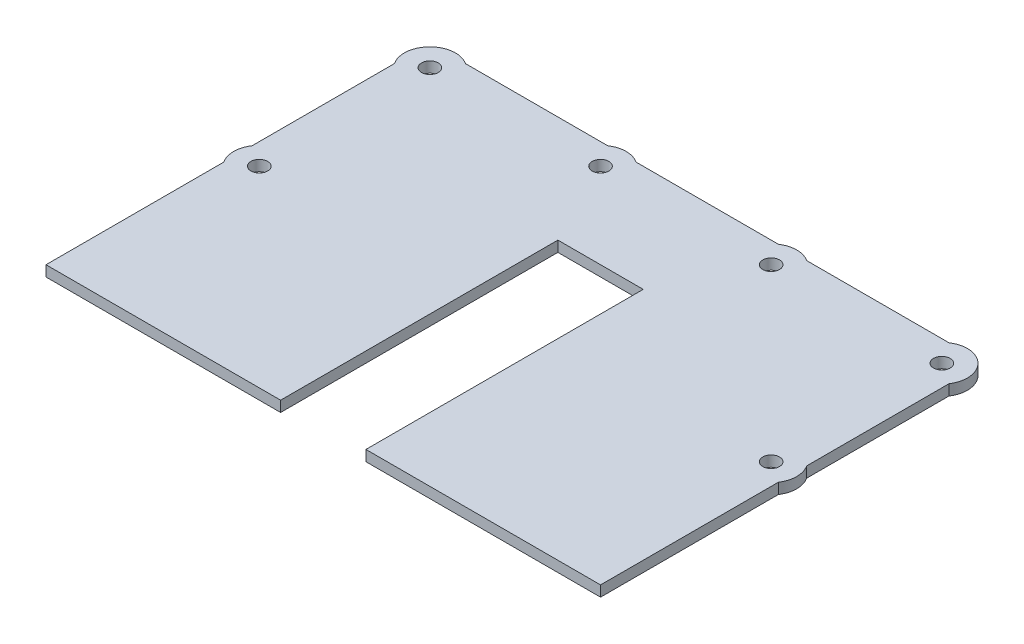
from build123d import *

# Parameters (mm, degrees)
SKETCH1_R           = 2.4892
BOSS_EXTRUDE1_DEPTH = 3.175
SKETCH7_W           = 69.85
SKETCH7_H           = 3.802256124
BOSS_EXTRUDE2_DEPTH = 3.175
SKETCH8_W           = 69.85
SKETCH8_H           = 3.802256124
BOSS_EXTRUDE4_DEPTH = 3.175
CUT_EXTRUDE1_DEPTH  = 203.596847026
SKETCH10_W          = 3.824961128
SKETCH10_H          = 3.22787153
CUT_EXTRUDE2_DEPTH  = 203.596847026


with BuildPart() as part:
    # Sketch1 → Boss-Extrude1 (new body)
    with BuildSketch(Plane(origin=(0, 0, 0), x_dir=(1, 0, 0), z_dir=(0, 1, 0))):
        with BuildLine():
            Line((-61.362113484, 114.3), (-103.737886516, 114.3))
            ThreePointArc((-103.737886516, 114.3), (-107.95, 115.57), (-112.162113484, 114.3))
            Line((-112.162113484, 114.3), (-154.537886516, 114.3))
            ThreePointArc((-154.537886516, 114.3), (-164.138153673, 113.338153673), (-165.1, 103.737886516))
            Line((-165.1, 103.737886516), (-165.1, 61.362113484))
            ThreePointArc((-165.1, 61.362113484), (-166.37, 57.15), (-165.1, 52.937886516))
            Line((-165.1, 52.937886516), (-165.1, 0))
            Line((-165.1, 0), (-95.25, 0))
            Line((-95.25, 0), (-95.25, 82.55))
            Line((-95.25, 82.55), (-69.85, 82.55))
            Line((-69.85, 82.55), (-69.85, 0))
            Line((-69.85, 0), (0, 0))
            Line((0, 0), (0, 52.937886516))
            ThreePointArc((0, 52.937886516), (1.27, 57.15), (0, 61.362113484))
            Line((0, 61.362113484), (0, 103.737886516))
            ThreePointArc((0, 103.737886516), (-0.961846327, 113.338153673), (-10.562113484, 114.3))
            Line((-10.562113484, 114.3), (-52.937886516, 114.3))
            ThreePointArc((-52.937886516, 114.3), (-57.15, 115.57), (-61.362113484, 114.3))
        make_face()
        with Locations((-158.75, 57.15)):
            Circle(SKETCH1_R, mode=Mode.SUBTRACT)
        with Locations((-6.35, 57.15)):
            Circle(SKETCH1_R, mode=Mode.SUBTRACT)
        with Locations((-158.75, 107.95)):
            Circle(SKETCH1_R, mode=Mode.SUBTRACT)
        with Locations((-107.95, 107.95)):
            Circle(SKETCH1_R, mode=Mode.SUBTRACT)
        with Locations((-57.15, 107.95)):
            Circle(SKETCH1_R, mode=Mode.SUBTRACT)
        with Locations((-6.35, 107.95)):
            Circle(SKETCH1_R, mode=Mode.SUBTRACT)
    extrude(amount=BOSS_EXTRUDE1_DEPTH)

    # Sketch7 → Boss-Extrude2 (add)
    with BuildSketch(Plane(origin=(0, 3.175, 0), x_dir=(1, 0, 0), z_dir=(0, 1, 0))):
        with Locations((-34.925, -1.901128062)):
            Rectangle(SKETCH7_W, SKETCH7_H)
    extrude(amount=-BOSS_EXTRUDE2_DEPTH)

    # Sketch8 → Boss-Extrude4 (add)
    with BuildSketch(Plane.XZ):
        with Locations((-130.175, 1.901128062)):
            Rectangle(SKETCH8_W, SKETCH8_H)
    extrude(amount=-BOSS_EXTRUDE4_DEPTH)

    # Sketch9 → Cut-Extrude1 (cut, through all)
    with BuildSketch(Plane.ZY.offset(165.1)):
        Polygon((0, 3.175), (3.802256124, 0), (3.802256124, 3.175), align=None)
    extrude(amount=-CUT_EXTRUDE1_DEPTH, mode=Mode.SUBTRACT)

    # Sketch10 → Cut-Extrude2 (cut, through all)
    with BuildSketch(Plane.ZY.offset(165.1)):
        with Locations((1.912480564, 1.613935765)):
            Rectangle(SKETCH10_W, SKETCH10_H)
    extrude(amount=-CUT_EXTRUDE2_DEPTH, mode=Mode.SUBTRACT)


solid = part.part
